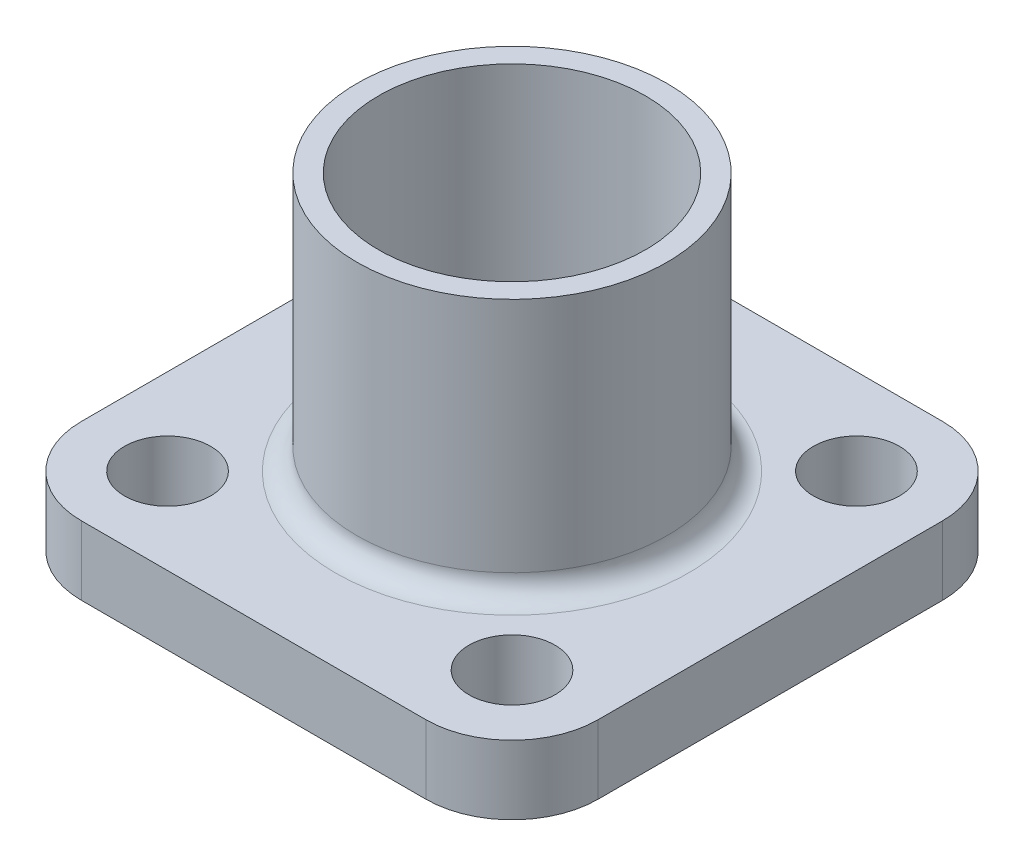
from build123d import *

# Parameters (mm, degrees)
SKETCH1_W           = 19.05
SKETCH1_H           = 19.05
SKETCH1_R           = 1.5875
SKETCH1_R_2         = 3.96875
BOSS_EXTRUDE1_DEPTH = 2.54
SKETCH2_R           = 5.715
SKETCH2_R_2         = 4.92125
BOSS_EXTRUDE2_DEPTH = 9.525
FILLET1_R           = 0.79375
FILLET2_R           = 3.175


with BuildPart() as part:
    # Sketch1 → Boss-Extrude1 (new body)
    with BuildSketch(Plane(origin=(0, 0, 0), x_dir=(1, 0, 0), z_dir=(0, 1, 0))):
        Rectangle(SKETCH1_W, SKETCH1_H)
        with Locations((-6.35, 6.35)):
            Circle(SKETCH1_R, mode=Mode.SUBTRACT)
        with Locations((6.35, 6.35)):
            Circle(SKETCH1_R, mode=Mode.SUBTRACT)
        with Locations((6.35, -6.35)):
            Circle(SKETCH1_R, mode=Mode.SUBTRACT)
        with Locations((-6.35, -6.35)):
            Circle(SKETCH1_R, mode=Mode.SUBTRACT)
        Circle(SKETCH1_R_2, mode=Mode.SUBTRACT)
    extrude(amount=BOSS_EXTRUDE1_DEPTH)

    # Sketch2 → Boss-Extrude2 (add)
    with BuildSketch(Plane(origin=(0, 2.54, 0), x_dir=(1, 0, 0), z_dir=(0, 1, 0))):
        Circle(SKETCH2_R)
        Circle(SKETCH2_R_2, mode=Mode.SUBTRACT)
    extrude(amount=BOSS_EXTRUDE2_DEPTH)

    # Fillet1
    fillet1_edges = [part.edges().sort_by_distance(p)[0] for p in [
        (-4.92125, 2.54, 0),
        (-5.715, 2.54, 0),
    ]]
    fillet(fillet1_edges, radius=FILLET1_R)

    # Fillet2
    fillet2_edges = [part.edges().sort_by_distance(p)[0] for p in [
        (9.525, 1.27, -9.525),
        (-9.525, 1.27, -9.525),
        (9.525, 1.27, 9.525),
        (-9.525, 1.27, 9.525),
    ]]
    fillet(fillet2_edges, radius=FILLET2_R)


solid = part.part
